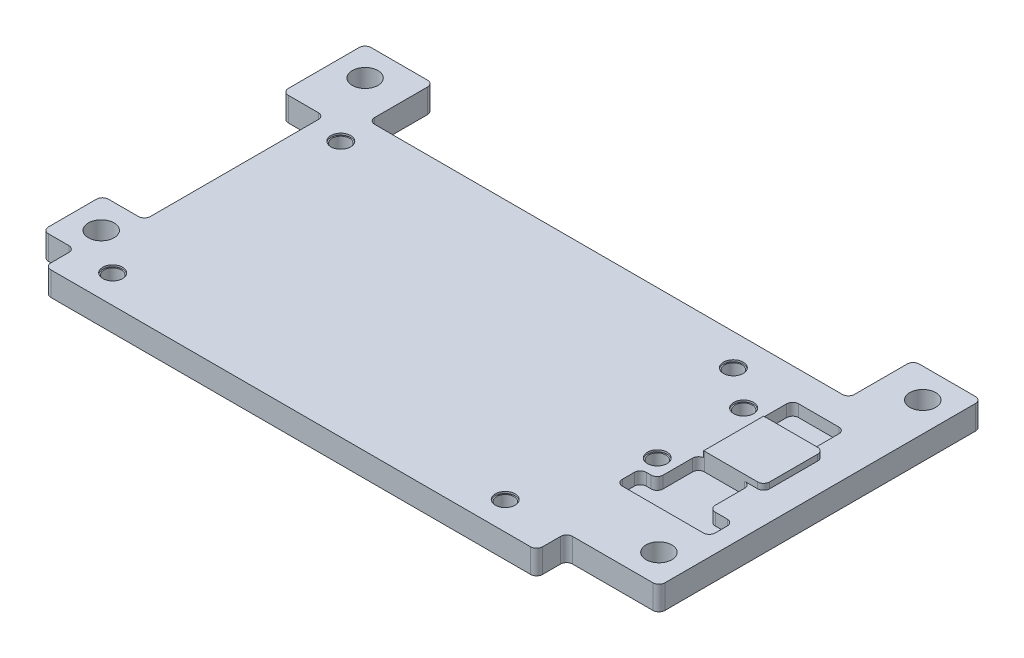
from build123d import *

# Parameters (mm, degrees)
SKETCH1_R                        = 2.15
MAIN_DEPTH                       = 4
WIRE_ESCAPES_REACH               = 120.496
SKETCH4_W                        = 7
SKETCH4_H                        = 30
BUTTON_CLEARANCE_REACH           = 120.496
SKETCH5_W                        = 80
SKETCH5_H                        = 10.8
M2_HEAT_SETS_D                   = 2.9
M2_HEAT_SETS_CBORE_D             = 3.3
M2_HEAT_SETS_CBORE_DEPTH         = 0.3
SKETCH7_W                        = 10
SKETCH7_H                        = 10
ENCODER_STANDOFF_DEPTH           = 1
SKETCH9_W                        = 8.7
SKETCH9_H                        = 5.7
ENCODER_TERMINAL_CLEARANCE_DEPTH = 2
FILLET1_R                        = 1


with BuildPart() as part:
    # Sketch1 → Main (new body)
    with BuildSketch(Plane(origin=(0, 0, 0), x_dir=(1, 0, 0), z_dir=(0, 1, 0))):
        Polygon((0, 0), (-102.8, 0), (-102.8, -53.8), (-97.4, -53.8), (-97.4, -58.8), (-15.4, -58.8), (-15.4, -53.8), (0, -53.8), align=None)
        with Locations(Location((-97.9, -4.9, 0), (0, 0, 270))):
            Circle(SKETCH1_R, mode=Mode.SUBTRACT)
        with Locations(Location((-97.9, -48.9, 0), (0, 0, 270))):
            Circle(SKETCH1_R, mode=Mode.SUBTRACT)
        with Locations(Location((-4.9, -4.9, 0), (0, 0, 270))):
            Circle(SKETCH1_R, mode=Mode.SUBTRACT)
        with Locations(Location((-4.9, -48.9, 0), (0, 0, 270))):
            Circle(SKETCH1_R, mode=Mode.SUBTRACT)
    extrude(amount=MAIN_DEPTH)

    # Sketch4 → Wire Escapes (cut, up to next)
    with BuildSketch(Plane(origin=(0, 4, 0), x_dir=(1, 0, 0), z_dir=(0, 1, 0)), mode=Mode.PRIVATE) as wire_escapes_sk1:
        with Locations((-99.3, -28.8)):
            Rectangle(SKETCH4_W, SKETCH4_H)
    wire_escapes_tool1 = extrude(wire_escapes_sk1.sketch, amount=-WIRE_ESCAPES_REACH, mode=Mode.PRIVATE) & part.part
    add(wire_escapes_tool1.solids().sort_by_distance((-99.3, 4, 28.8))[0], mode=Mode.SUBTRACT)

    # Sketch5 → Button Clearance (cut, up to next)
    with BuildSketch(Plane(origin=(0, 4, 0), x_dir=(1, 0, 0), z_dir=(0, 1, 0)), mode=Mode.PRIVATE) as button_clearance_sk1:
        with Locations((-51.4, -5.4)):
            Rectangle(SKETCH5_W, SKETCH5_H)
    button_clearance_tool1 = extrude(button_clearance_sk1.sketch, amount=-BUTTON_CLEARANCE_REACH, mode=Mode.PRIVATE) & part.part
    add(button_clearance_tool1.solids().sort_by_distance((-51.4, 4, 5.4))[0], mode=Mode.SUBTRACT)

    # M2 Heat Sets (through all)
    with Locations(Plane(origin=(-90.8, 4, 16.05), x_dir=(0, 0, 1), z_dir=(0, 1, 0))):
        with Locations((0, 0), (38.04, 0), (38.04, 65.46), (0, 65.46), (4.95, 72.125), (19.35, 72.125)):
            CounterBoreHole(M2_HEAT_SETS_D / 2, M2_HEAT_SETS_CBORE_D / 2, M2_HEAT_SETS_CBORE_DEPTH)

    # Sketch7 → Encoder Standoff (add)
    with BuildSketch(Plane(origin=(0, 4, 0), x_dir=(1, 0, 0), z_dir=(0, 1, 0))):
        with Locations((-9.8375, -26.5)):
            Rectangle(SKETCH7_W, SKETCH7_H)
    extrude(amount=ENCODER_STANDOFF_DEPTH)

    # Sketch9 → Encoder Terminal Clearance (cut)
    with BuildSketch(Plane(origin=(0, 4, 0), x_dir=(1, 0, 0), z_dir=(0, 1, 0))):
        with Locations((-11.35, -18.65)):
            Rectangle(SKETCH9_W, SKETCH9_H)
        Polygon((-15.7, -31.5), (-7, -31.5), (-7, -38.4), (-3, -38.4), (-3, -42.4), (-18.5, -42.4), (-18.5, -38.4), (-15.7, -38.4), align=None)
    extrude(amount=-ENCODER_TERMINAL_CLEARANCE_DEPTH, mode=Mode.SUBTRACT)

    # Fillet1
    # the kernel refuses this fillet: 1 mm, written as the material it adds along each edge
    with BuildSketch(Plane(origin=(-15.4, 0, 53.8), x_dir=(1, 0, 0), z_dir=(0, 1, 0)), Plane(origin=(-97.4, 0, 53.8), x_dir=(0, 0, 1), z_dir=(0, 1, 0)), Plane(origin=(-11.4, 4, 10.8), x_dir=(0, 0, -1), z_dir=(0, -1, 0)), Plane(origin=(-91.4, 4, 10.8), x_dir=(1, 0, 0), z_dir=(0, -1, 0))) as fillet1_piece_1:
        with BuildLine():
            CenterArc((FILLET1_R, -FILLET1_R), FILLET1_R, 90, 90)
            Line((0, -FILLET1_R), (0, 0))
            Line((0, 0), (FILLET1_R, 0))
        make_face()
    extrude(amount=4)
    with BuildSketch(Plane(origin=(-95.8, 4, 43.8), x_dir=(-1, 0, 0), z_dir=(0, -1, 0)), Plane(origin=(-95.8, 4, 13.8), x_dir=(0, 0, 1), z_dir=(0, -1, 0))) as fillet1_piece_2:
        with BuildLine():
            CenterArc((FILLET1_R, FILLET1_R), FILLET1_R, 180, 90)
            Line((0, FILLET1_R), (0, 0))
            Line((0, 0), (FILLET1_R, 0))
        make_face()
    extrude(amount=4)
    with BuildSketch(Plane(origin=(-18.5, 4, 42.4), x_dir=(0, 0, -1), z_dir=(0, -1, 0)), Plane(origin=(-3, 4, 42.4), x_dir=(-1, 0, 0), z_dir=(0, -1, 0)), Plane(origin=(-3, 4, 38.4), x_dir=(0, 0, 1), z_dir=(0, -1, 0)), Plane(origin=(-18.5, 4, 38.4), x_dir=(1, 0, 0), z_dir=(0, -1, 0)), Plane(origin=(-7, 4, 15.8), x_dir=(0, 0, 1), z_dir=(0, -1, 0)), Plane(origin=(-15.7, 4, 15.8), x_dir=(1, 0, 0), z_dir=(0, -1, 0)), Plane(origin=(-15.7, 4, 31.5), x_dir=(1, 0, 0), z_dir=(0, -1, 0)), Plane(origin=(-7, 4, 21.5), x_dir=(-1, 0, 0), z_dir=(0, -1, 0))) as fillet1_piece_3:
        with BuildLine():
            CenterArc((FILLET1_R, FILLET1_R), FILLET1_R, 180, 90)
            Line((0, FILLET1_R), (0, 0))
            Line((0, 0), (FILLET1_R, 0))
        make_face()
    extrude(amount=2)
    with BuildSketch(Plane(origin=(-15.7, 6.5, 21.5), x_dir=(1, 0, 0), z_dir=(0, -1, 0))) as fillet1_piece_4_section:
        with BuildLine():
            CenterArc((FILLET1_R, -FILLET1_R), FILLET1_R, 90, 90)
            Line((0, -FILLET1_R), (0, 0))
            Line((0, 0), (FILLET1_R, 0))
        make_face()
    fillet1_piece_4 = extrude(amount=4.5, mode=Mode.PRIVATE)
    fillet1_piece_4 = split(fillet1_piece_4, bisect_by=Plane(origin=(-14.8375, 4.5, 21.497152865), z_dir=(1, 0, 0)), keep=Keep.TOP, mode=Mode.PRIVATE)
    fillet1_piece_4 = split(fillet1_piece_4, bisect_by=Plane(origin=(-14.803157734, 5, 21.497152865), z_dir=(0, -1, 0)), keep=Keep.TOP, mode=Mode.PRIVATE)
    add(fillet1_piece_4)
    with BuildSketch(Plane(origin=(-15.7, 4, 21.5), x_dir=(1, 0, 0), z_dir=(0, -1, 0)), Plane(origin=(-7, 4, 31.5), x_dir=(-1, 0, 0), z_dir=(0, -1, 0))) as fillet1_piece_5:
        with BuildLine():
            CenterArc((FILLET1_R, -FILLET1_R), FILLET1_R, 90, 90)
            Line((0, -FILLET1_R), (0, 0))
            Line((0, 0), (FILLET1_R, 0))
        make_face()
    extrude(amount=2)
    with BuildSketch(Plane(origin=(-15.7, 6.5, 31.5), x_dir=(1, 0, 0), z_dir=(0, -1, 0))) as fillet1_piece_6_section:
        with BuildLine():
            CenterArc((FILLET1_R, FILLET1_R), FILLET1_R, 180, 90)
            Line((0, FILLET1_R), (0, 0))
            Line((0, 0), (FILLET1_R, 0))
        make_face()
    fillet1_piece_6 = extrude(amount=4.5, mode=Mode.PRIVATE)
    fillet1_piece_6 = split(fillet1_piece_6, bisect_by=Plane(origin=(-14.8375, 4.5, 31.502847135), z_dir=(1, 0, 0)), keep=Keep.TOP, mode=Mode.PRIVATE)
    fillet1_piece_6 = split(fillet1_piece_6, bisect_by=Plane(origin=(-14.803157734, 5, 31.502847135), z_dir=(0, -1, 0)), keep=Keep.TOP, mode=Mode.PRIVATE)
    add(fillet1_piece_6)
    # the kernel refuses this fillet: 1 mm, written as the material it takes off along each edge
    with BuildSketch(Plane(origin=(0, -2.5, 0), x_dir=(-1, 0, 0), z_dir=(0, 1, 0)), Plane(origin=(0, -2.5, 53.8), x_dir=(0, 0, -1), z_dir=(0, 1, 0)), Plane(origin=(-102.8, -2.5, 0), x_dir=(0, 0, 1), z_dir=(0, 1, 0)), Plane(origin=(-15.4, -2.5, 58.8), x_dir=(0, 0, -1), z_dir=(0, 1, 0)), Plane(origin=(-102.8, -2.5, 53.8), x_dir=(1, 0, 0), z_dir=(0, 1, 0)), Plane(origin=(-97.4, -2.5, 58.8), x_dir=(1, 0, 0), z_dir=(0, 1, 0)), Plane(origin=(-11.4, 6.5, 0), x_dir=(1, 0, 0), z_dir=(0, -1, 0))) as fillet1_2_piece_1:
        with BuildLine():
            CenterArc((FILLET1_R, FILLET1_R), FILLET1_R, 180, 90)
            Line((0, FILLET1_R), (0, 0))
            Line((0, 0), (FILLET1_R, 0))
        make_face()
    extrude(amount=9, mode=Mode.SUBTRACT)
    with BuildSketch(Plane(origin=(-102.8, 6.5, 43.8), x_dir=(0, 0, 1), z_dir=(0, -1, 0)), Plane(origin=(-102.8, 6.5, 13.8), x_dir=(1, 0, 0), z_dir=(0, -1, 0)), Plane(origin=(-91.4, 6.5, 0), x_dir=(-1, 0, 0), z_dir=(0, -1, 0))) as fillet1_2_piece_2:
        with BuildLine():
            CenterArc((FILLET1_R, -FILLET1_R), FILLET1_R, 90, 90)
            Line((0, -FILLET1_R), (0, 0))
            Line((0, 0), (FILLET1_R, 0))
        make_face()
    extrude(amount=9, mode=Mode.SUBTRACT)
    with BuildSketch(Plane(origin=(-4.8375, 4, 21.5), x_dir=(0, 0, 1), z_dir=(0, 1, 0)), Plane(origin=(-4.8375, 4, 31.5), x_dir=(-1, 0, 0), z_dir=(0, 1, 0))) as fillet1_2_piece_3:
        with BuildLine():
            CenterArc((FILLET1_R, -FILLET1_R), FILLET1_R, 90, 90)
            Line((0, -FILLET1_R), (0, 0))
            Line((0, 0), (FILLET1_R, 0))
        make_face()
    extrude(amount=3.5, mode=Mode.SUBTRACT)
    with BuildSketch(Plane(origin=(-15.7, 6.5, 38.4), x_dir=(-1, 0, 0), z_dir=(0, -1, 0))) as fillet1_2_piece_4:
        with BuildLine():
            CenterArc((FILLET1_R, FILLET1_R), FILLET1_R, 180, 90)
            Line((0, FILLET1_R), (0, 0))
            Line((0, 0), (FILLET1_R, 0))
        make_face()
    extrude(amount=4.5, mode=Mode.SUBTRACT)
    with BuildSketch(Plane(origin=(-7, 6.5, 38.4), x_dir=(1, 0, 0), z_dir=(0, -1, 0))) as fillet1_2_piece_5:
        with BuildLine():
            CenterArc((FILLET1_R, -FILLET1_R), FILLET1_R, 90, 90)
            Line((0, -FILLET1_R), (0, 0))
            Line((0, 0), (FILLET1_R, 0))
        make_face()
    extrude(amount=4.5, mode=Mode.SUBTRACT)


solid = part.part
